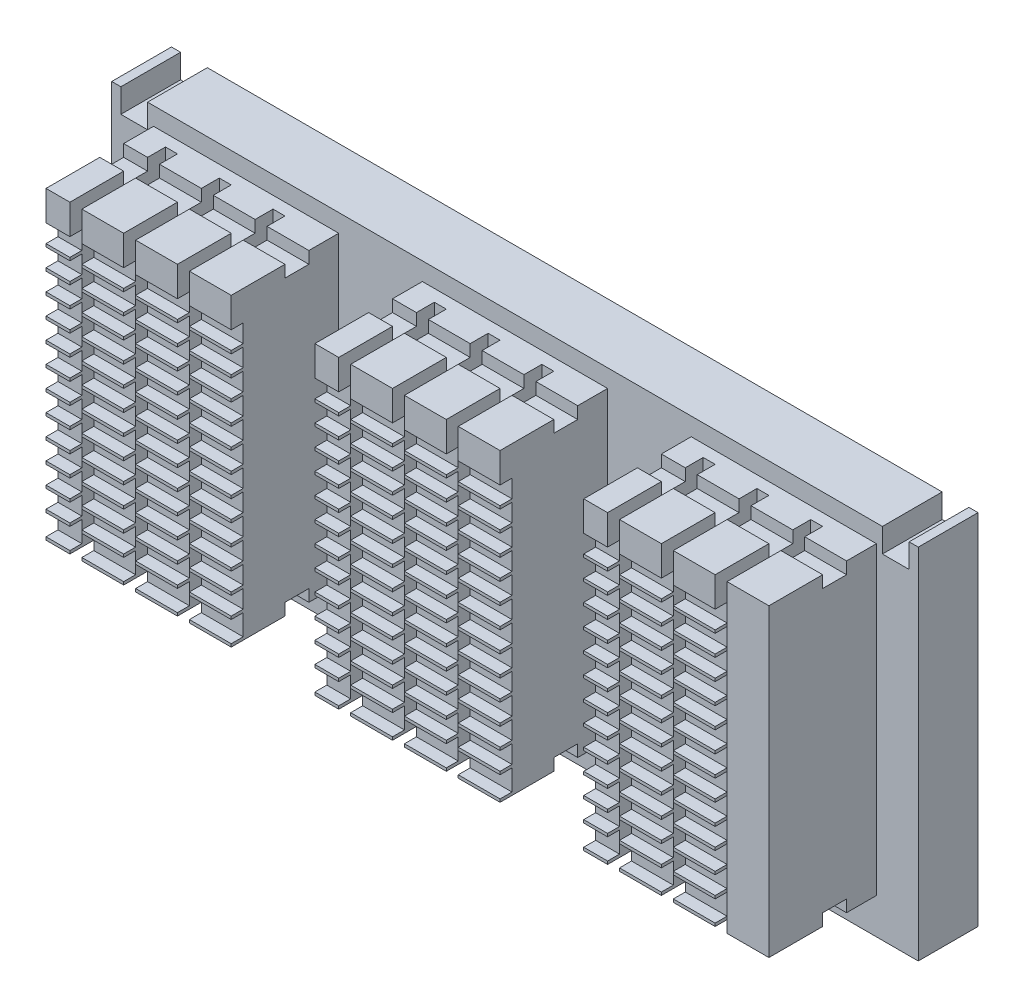
from build123d import *

# Parameters (mm, degrees)
SKETCH1_W           = 135
SKETCH1_H           = 10
BOSS_EXTRUDE1_DEPTH = 60
SKETCH2_W           = 133
SKETCH2_H           = 8
CUT_EXTRUDE1_DEPTH  = 50
SKETCH3_W           = 6
SKETCH3_H           = 10
CUT_EXTRUDE2_DEPTH  = 4
SKETCH4_W           = 1.53
SKETCH4_H           = 10
SKETCH4_W_2         = 1.528782652
BOSS_EXTRUDE2_DEPTH = 4
SKETCH5_W           = 31
SKETCH5_H           = 51
BOSS_EXTRUDE4_DEPTH = 18
SKETCH7_W           = 2
SKETCH7_H           = 16
CUT_EXTRUDE3_DEPTH  = 148.641457592
SKETCH8_W           = 31
SKETCH8_H           = 4
CUT_EXTRUDE4_DEPTH  = 2
SKETCH9_W           = 31
SKETCH9_H           = 4
CUT_EXTRUDE5_DEPTH  = 2
SKETCH10_W          = 7
SKETCH10_H          = 3
SKETCH10_W_2        = 4
SKETCH10_H_2        = 3.5
CUT_EXTRUDE6_DEPTH  = 2


with BuildPart() as part:
    # Sketch1 → Boss-Extrude1 (new body)
    with BuildSketch(Plane(origin=(0, 0, 0), x_dir=(1, 0, 0), z_dir=(0, 1, 0))):
        with Locations((67.5, 5)):
            Rectangle(SKETCH1_W, SKETCH1_H)
    extrude(amount=BOSS_EXTRUDE1_DEPTH)

    # Sketch2 → Cut-Extrude1 (cut)
    with BuildSketch(Plane(origin=(0, 0, 0), x_dir=(-1, 0, 0), z_dir=(0, -1, 0))):
        with Locations((-67.5, 5)):
            Rectangle(SKETCH2_W, SKETCH2_H)
    extrude(amount=-CUT_EXTRUDE1_DEPTH, mode=Mode.SUBTRACT)

    # Sketch3 → Cut-Extrude2 (cut)
    with BuildSketch(Plane(origin=(0, 60, 0), x_dir=(1, 0, 0), z_dir=(0, 1, 0))):
        with Locations((3, 5)):
            Rectangle(SKETCH3_W, SKETCH3_H)
        with Locations((132, 5)):
            Rectangle(SKETCH3_W, SKETCH3_H)
    extrude(amount=-CUT_EXTRUDE2_DEPTH, mode=Mode.SUBTRACT)

    # Sketch4 → Boss-Extrude2 (add)
    with BuildSketch(Plane(origin=(0, 56, 0), x_dir=(1, 0, 0), z_dir=(0, 1, 0))):
        with Locations((134.235, 5)):
            Rectangle(SKETCH4_W, SKETCH4_H)
        with Locations((0.764391326, 5)):
            Rectangle(SKETCH4_W_2, SKETCH4_H)
    extrude(amount=BOSS_EXTRUDE2_DEPTH)

    # Sketch5 → Boss-Extrude4 (add)
    with BuildSketch(Plane.XY):
        with Locations((112.5, 31.5)):
            Rectangle(SKETCH5_W, SKETCH5_H)
        with Locations((67.5, 31.5)):
            Rectangle(SKETCH5_W, SKETCH5_H)
        with Locations((22.5, 31.5)):
            Rectangle(SKETCH5_W, SKETCH5_H)
    extrude(amount=BOSS_EXTRUDE4_DEPTH)

    # Sketch7 → Cut-Extrude3 (cut, through all)
    with BuildSketch(Plane(origin=(0, 57, 0), x_dir=(1, 0, 0), z_dir=(0, 1, 0))):
        with Locations((120, -10)):
            Rectangle(SKETCH7_W, SKETCH7_H)
        with Locations((111, -10)):
            Rectangle(SKETCH7_W, SKETCH7_H)
        with Locations((102, -10)):
            Rectangle(SKETCH7_W, SKETCH7_H)
        with Locations((75, -10)):
            Rectangle(SKETCH7_W, SKETCH7_H)
        with Locations((66, -10)):
            Rectangle(SKETCH7_W, SKETCH7_H)
        with Locations((57, -10)):
            Rectangle(SKETCH7_W, SKETCH7_H)
        with Locations((21, -10)):
            Rectangle(SKETCH7_W, SKETCH7_H)
        with Locations((12, -10)):
            Rectangle(SKETCH7_W, SKETCH7_H)
        with Locations((30, -10)):
            Rectangle(SKETCH7_W, SKETCH7_H)
    extrude(amount=-CUT_EXTRUDE3_DEPTH, mode=Mode.SUBTRACT)

    # Sketch8 → Cut-Extrude4 (cut)
    with BuildSketch(Plane(origin=(0, 57, 0), x_dir=(1, 0, 0), z_dir=(0, 1, 0))):
        with Locations((112.5, -7)):
            Rectangle(SKETCH8_W, SKETCH8_H)
        with Locations((67.5, -7)):
            Rectangle(SKETCH8_W, SKETCH8_H)
        with Locations((22.5, -7)):
            Rectangle(SKETCH8_W, SKETCH8_H)
    extrude(amount=-CUT_EXTRUDE4_DEPTH, mode=Mode.SUBTRACT)

    # Sketch9 → Cut-Extrude5 (cut)
    with BuildSketch(Plane.XZ.offset(-6)):
        with Locations((112.5, 7)):
            Rectangle(SKETCH9_W, SKETCH9_H)
        with Locations((67.5, 7)):
            Rectangle(SKETCH9_W, SKETCH9_H)
        with Locations((22.5, 7)):
            Rectangle(SKETCH9_W, SKETCH9_H)
    extrude(amount=-CUT_EXTRUDE5_DEPTH, mode=Mode.SUBTRACT)

    # Sketch10 → Cut-Extrude6 (cut)
    with BuildSketch(Plane.XY.offset(18)):
        with Locations((115.5, 50.5)):
            Rectangle(SKETCH10_W, SKETCH10_H)
        with Locations((115.5, 47)):
            Rectangle(SKETCH10_W, SKETCH10_H)
        with Locations((106.5, 50.5)):
            Rectangle(SKETCH10_W, SKETCH10_H)
        with Locations((106.5, 47)):
            Rectangle(SKETCH10_W, SKETCH10_H)
        with Locations((115.5, 43.5)):
            Rectangle(SKETCH10_W, SKETCH10_H)
        with Locations((99, 50.5)):
            Rectangle(SKETCH10_W_2, SKETCH10_H)
        with Locations((99, 47)):
            Rectangle(SKETCH10_W_2, SKETCH10_H)
        with Locations((106.5, 43.5)):
            Rectangle(SKETCH10_W, SKETCH10_H)
        with Locations((115.5, 40)):
            Rectangle(SKETCH10_W, SKETCH10_H)
        with Locations((79.5, 50.5)):
            Rectangle(SKETCH10_W, SKETCH10_H)
        with Locations((79.5, 47)):
            Rectangle(SKETCH10_W, SKETCH10_H)
        with Locations((99, 43.5)):
            Rectangle(SKETCH10_W_2, SKETCH10_H)
        with Locations((106.5, 40)):
            Rectangle(SKETCH10_W, SKETCH10_H)
        with Locations((115.5, 36.5)):
            Rectangle(SKETCH10_W, SKETCH10_H)
        with Locations((70.5, 50.5)):
            Rectangle(SKETCH10_W, SKETCH10_H)
        with Locations((70.5, 47)):
            Rectangle(SKETCH10_W, SKETCH10_H)
        with Locations((79.5, 43.5)):
            Rectangle(SKETCH10_W, SKETCH10_H)
        with Locations((99, 40)):
            Rectangle(SKETCH10_W_2, SKETCH10_H)
        with Locations((106.5, 36.5)):
            Rectangle(SKETCH10_W, SKETCH10_H)
        with Locations((115.5, 33)):
            Rectangle(SKETCH10_W, SKETCH10_H)
        with Locations((61.5, 50.5)):
            Rectangle(SKETCH10_W, SKETCH10_H)
        with Locations((61.5, 47)):
            Rectangle(SKETCH10_W, SKETCH10_H)
        with Locations((70.5, 43.5)):
            Rectangle(SKETCH10_W, SKETCH10_H)
        with Locations((79.5, 40)):
            Rectangle(SKETCH10_W, SKETCH10_H)
        with Locations((99, 36.5)):
            Rectangle(SKETCH10_W_2, SKETCH10_H)
        with Locations((106.5, 33)):
            Rectangle(SKETCH10_W, SKETCH10_H)
        with Locations((115.5, 29.5)):
            Rectangle(SKETCH10_W, SKETCH10_H)
        with Locations((54, 50.5)):
            Rectangle(SKETCH10_W_2, SKETCH10_H)
        with Locations((54, 47)):
            Rectangle(SKETCH10_W_2, SKETCH10_H)
        with Locations((61.5, 43.5)):
            Rectangle(SKETCH10_W, SKETCH10_H)
        with Locations((70.5, 40)):
            Rectangle(SKETCH10_W, SKETCH10_H)
        with Locations((79.5, 36.5)):
            Rectangle(SKETCH10_W, SKETCH10_H)
        with Locations((99, 33)):
            Rectangle(SKETCH10_W_2, SKETCH10_H)
        with Locations((106.5, 29.5)):
            Rectangle(SKETCH10_W, SKETCH10_H)
        with Locations((115.5, 26)):
            Rectangle(SKETCH10_W, SKETCH10_H)
        with Locations((34.5, 50.5)):
            Rectangle(SKETCH10_W, SKETCH10_H)
        with Locations((34.5, 47)):
            Rectangle(SKETCH10_W, SKETCH10_H)
        with Locations((54, 43.5)):
            Rectangle(SKETCH10_W_2, SKETCH10_H)
        with Locations((61.5, 40)):
            Rectangle(SKETCH10_W, SKETCH10_H)
        with Locations((70.5, 36.5)):
            Rectangle(SKETCH10_W, SKETCH10_H)
        with Locations((79.5, 33)):
            Rectangle(SKETCH10_W, SKETCH10_H)
        with Locations((99, 29.5)):
            Rectangle(SKETCH10_W_2, SKETCH10_H)
        with Locations((106.5, 26)):
            Rectangle(SKETCH10_W, SKETCH10_H)
        with Locations((115.5, 22.5)):
            Rectangle(SKETCH10_W, SKETCH10_H)
        with Locations((25.5, 50.5)):
            Rectangle(SKETCH10_W, SKETCH10_H)
        with Locations((25.5, 47)):
            Rectangle(SKETCH10_W, SKETCH10_H)
        with Locations((34.5, 43.5)):
            Rectangle(SKETCH10_W, SKETCH10_H)
        with Locations((54, 40)):
            Rectangle(SKETCH10_W_2, SKETCH10_H)
        with Locations((61.5, 36.5)):
            Rectangle(SKETCH10_W, SKETCH10_H)
        with Locations((70.5, 33)):
            Rectangle(SKETCH10_W, SKETCH10_H)
        with Locations((79.5, 29.5)):
            Rectangle(SKETCH10_W, SKETCH10_H)
        with Locations((99, 26)):
            Rectangle(SKETCH10_W_2, SKETCH10_H)
        with Locations((106.5, 22.5)):
            Rectangle(SKETCH10_W, SKETCH10_H)
        with Locations((115.5, 19)):
            Rectangle(SKETCH10_W, SKETCH10_H)
        with Locations((16.5, 50.5)):
            Rectangle(SKETCH10_W, SKETCH10_H)
        with Locations((16.5, 47)):
            Rectangle(SKETCH10_W, SKETCH10_H)
        with Locations((25.5, 43.5)):
            Rectangle(SKETCH10_W, SKETCH10_H)
        with Locations((34.5, 40)):
            Rectangle(SKETCH10_W, SKETCH10_H)
        with Locations((54, 36.5)):
            Rectangle(SKETCH10_W_2, SKETCH10_H)
        with Locations((61.5, 33)):
            Rectangle(SKETCH10_W, SKETCH10_H)
        with Locations((70.5, 29.5)):
            Rectangle(SKETCH10_W, SKETCH10_H)
        with Locations((79.5, 26)):
            Rectangle(SKETCH10_W, SKETCH10_H)
        with Locations((99, 22.5)):
            Rectangle(SKETCH10_W_2, SKETCH10_H)
        with Locations((106.5, 19)):
            Rectangle(SKETCH10_W, SKETCH10_H)
        with Locations((115.5, 15.5)):
            Rectangle(SKETCH10_W, SKETCH10_H)
        with Locations((9, 50.5)):
            Rectangle(SKETCH10_W_2, SKETCH10_H)
        with Locations((9, 47)):
            Rectangle(SKETCH10_W_2, SKETCH10_H)
        with Locations((16.5, 43.5)):
            Rectangle(SKETCH10_W, SKETCH10_H)
        with Locations((25.5, 40)):
            Rectangle(SKETCH10_W, SKETCH10_H)
        with Locations((34.5, 36.5)):
            Rectangle(SKETCH10_W, SKETCH10_H)
        with Locations((54, 33)):
            Rectangle(SKETCH10_W_2, SKETCH10_H)
        with Locations((61.5, 29.5)):
            Rectangle(SKETCH10_W, SKETCH10_H)
        with Locations((70.5, 26)):
            Rectangle(SKETCH10_W, SKETCH10_H)
        with Locations((79.5, 22.5)):
            Rectangle(SKETCH10_W, SKETCH10_H)
        with Locations((99, 19)):
            Rectangle(SKETCH10_W_2, SKETCH10_H)
        with Locations((106.5, 15.5)):
            Rectangle(SKETCH10_W, SKETCH10_H)
        with Locations((115.5, 12)):
            Rectangle(SKETCH10_W, SKETCH10_H)
        with Locations((9, 43.5)):
            Rectangle(SKETCH10_W_2, SKETCH10_H)
        with Locations((16.5, 40)):
            Rectangle(SKETCH10_W, SKETCH10_H)
        with Locations((25.5, 36.5)):
            Rectangle(SKETCH10_W, SKETCH10_H)
        with Locations((34.5, 33)):
            Rectangle(SKETCH10_W, SKETCH10_H)
        with Locations((54, 29.5)):
            Rectangle(SKETCH10_W_2, SKETCH10_H)
        with Locations((61.5, 26)):
            Rectangle(SKETCH10_W, SKETCH10_H)
        with Locations((70.5, 22.5)):
            Rectangle(SKETCH10_W, SKETCH10_H)
        with Locations((79.5, 19)):
            Rectangle(SKETCH10_W, SKETCH10_H)
        with Locations((99, 15.5)):
            Rectangle(SKETCH10_W_2, SKETCH10_H)
        with Locations((106.5, 12)):
            Rectangle(SKETCH10_W, SKETCH10_H)
        with Locations((115.5, 8.25)):
            Rectangle(SKETCH10_W, SKETCH10_H_2)
        with Locations((9, 40)):
            Rectangle(SKETCH10_W_2, SKETCH10_H)
        with Locations((16.5, 36.5)):
            Rectangle(SKETCH10_W, SKETCH10_H)
        with Locations((25.5, 33)):
            Rectangle(SKETCH10_W, SKETCH10_H)
        with Locations((34.5, 29.5)):
            Rectangle(SKETCH10_W, SKETCH10_H)
        with Locations((54, 26)):
            Rectangle(SKETCH10_W_2, SKETCH10_H)
        with Locations((61.5, 22.5)):
            Rectangle(SKETCH10_W, SKETCH10_H)
        with Locations((70.5, 19)):
            Rectangle(SKETCH10_W, SKETCH10_H)
        with Locations((79.5, 15.5)):
            Rectangle(SKETCH10_W, SKETCH10_H)
        with Locations((99, 12)):
            Rectangle(SKETCH10_W_2, SKETCH10_H)
        with Locations((106.5, 8.25)):
            Rectangle(SKETCH10_W, SKETCH10_H_2)
        with Locations((9, 36.5)):
            Rectangle(SKETCH10_W_2, SKETCH10_H)
        with Locations((16.5, 33)):
            Rectangle(SKETCH10_W, SKETCH10_H)
        with Locations((25.5, 29.5)):
            Rectangle(SKETCH10_W, SKETCH10_H)
        with Locations((34.5, 26)):
            Rectangle(SKETCH10_W, SKETCH10_H)
        with Locations((54, 22.5)):
            Rectangle(SKETCH10_W_2, SKETCH10_H)
        with Locations((61.5, 19)):
            Rectangle(SKETCH10_W, SKETCH10_H)
        with Locations((70.5, 15.5)):
            Rectangle(SKETCH10_W, SKETCH10_H)
        with Locations((79.5, 12)):
            Rectangle(SKETCH10_W, SKETCH10_H)
        with Locations((99, 8.25)):
            Rectangle(SKETCH10_W_2, SKETCH10_H_2)
        with Locations((9, 33)):
            Rectangle(SKETCH10_W_2, SKETCH10_H)
        with Locations((16.5, 29.5)):
            Rectangle(SKETCH10_W, SKETCH10_H)
        with Locations((25.5, 26)):
            Rectangle(SKETCH10_W, SKETCH10_H)
        with Locations((34.5, 22.5)):
            Rectangle(SKETCH10_W, SKETCH10_H)
        with Locations((54, 19)):
            Rectangle(SKETCH10_W_2, SKETCH10_H)
        with Locations((61.5, 15.5)):
            Rectangle(SKETCH10_W, SKETCH10_H)
        with Locations((70.5, 12)):
            Rectangle(SKETCH10_W, SKETCH10_H)
        with Locations((79.5, 8.25)):
            Rectangle(SKETCH10_W, SKETCH10_H_2)
        with Locations((9, 29.5)):
            Rectangle(SKETCH10_W_2, SKETCH10_H)
        with Locations((16.5, 26)):
            Rectangle(SKETCH10_W, SKETCH10_H)
        with Locations((25.5, 22.5)):
            Rectangle(SKETCH10_W, SKETCH10_H)
        with Locations((34.5, 19)):
            Rectangle(SKETCH10_W, SKETCH10_H)
        with Locations((54, 15.5)):
            Rectangle(SKETCH10_W_2, SKETCH10_H)
        with Locations((61.5, 12)):
            Rectangle(SKETCH10_W, SKETCH10_H)
        with Locations((70.5, 8.25)):
            Rectangle(SKETCH10_W, SKETCH10_H_2)
        with Locations((9, 26)):
            Rectangle(SKETCH10_W_2, SKETCH10_H)
        with Locations((16.5, 22.5)):
            Rectangle(SKETCH10_W, SKETCH10_H)
        with Locations((25.5, 19)):
            Rectangle(SKETCH10_W, SKETCH10_H)
        with Locations((34.5, 15.5)):
            Rectangle(SKETCH10_W, SKETCH10_H)
        with Locations((54, 12)):
            Rectangle(SKETCH10_W_2, SKETCH10_H)
        with Locations((61.5, 8.25)):
            Rectangle(SKETCH10_W, SKETCH10_H_2)
        with Locations((9, 22.5)):
            Rectangle(SKETCH10_W_2, SKETCH10_H)
        with Locations((16.5, 19)):
            Rectangle(SKETCH10_W, SKETCH10_H)
        with Locations((25.5, 15.5)):
            Rectangle(SKETCH10_W, SKETCH10_H)
        with Locations((34.5, 12)):
            Rectangle(SKETCH10_W, SKETCH10_H)
        with Locations((54, 8.25)):
            Rectangle(SKETCH10_W_2, SKETCH10_H_2)
        with Locations((9, 19)):
            Rectangle(SKETCH10_W_2, SKETCH10_H)
        with Locations((16.5, 15.5)):
            Rectangle(SKETCH10_W, SKETCH10_H)
        with Locations((25.5, 12)):
            Rectangle(SKETCH10_W, SKETCH10_H)
        with Locations((34.5, 8.25)):
            Rectangle(SKETCH10_W, SKETCH10_H_2)
        with Locations((9, 15.5)):
            Rectangle(SKETCH10_W_2, SKETCH10_H)
        with Locations((16.5, 12)):
            Rectangle(SKETCH10_W, SKETCH10_H)
        with Locations((25.5, 8.25)):
            Rectangle(SKETCH10_W, SKETCH10_H_2)
        with Locations((9, 12)):
            Rectangle(SKETCH10_W_2, SKETCH10_H)
        with Locations((16.5, 8.25)):
            Rectangle(SKETCH10_W, SKETCH10_H_2)
        with Locations((9, 8.25)):
            Rectangle(SKETCH10_W_2, SKETCH10_H_2)
    extrude(amount=-CUT_EXTRUDE6_DEPTH, mode=Mode.SUBTRACT)


solid = part.part
